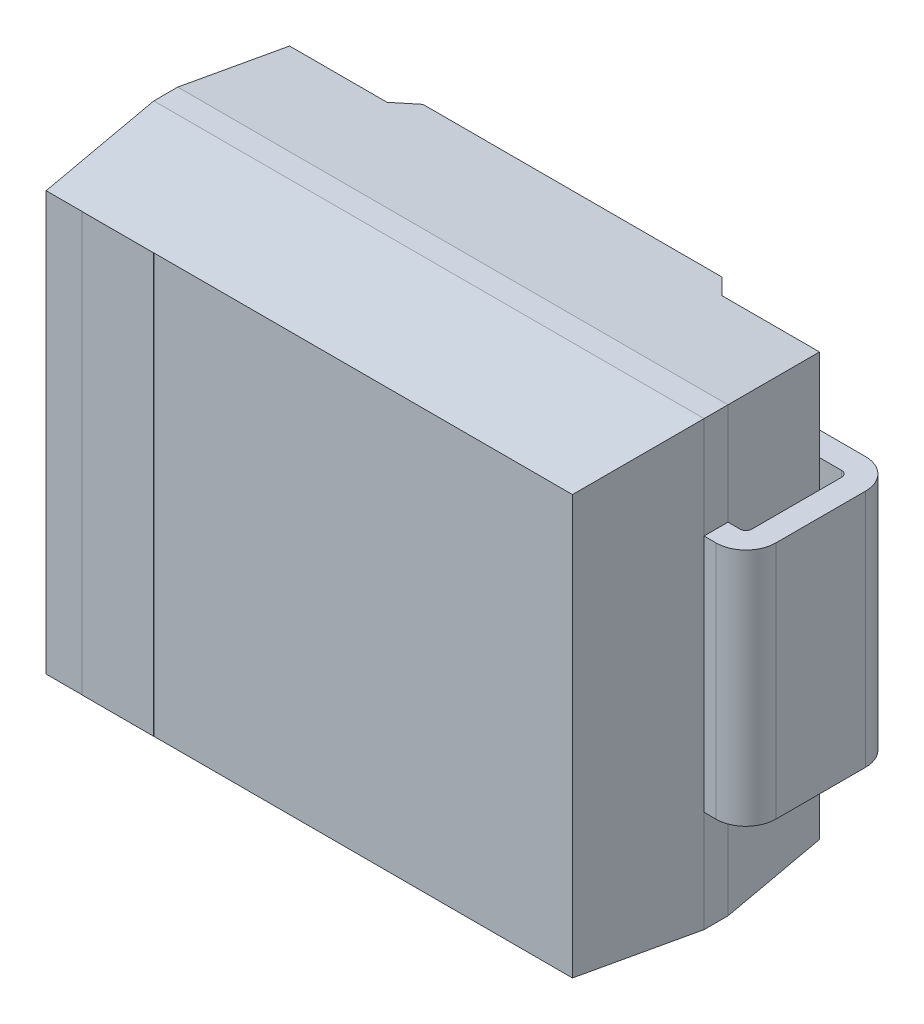
from build123d import *
from OCP.BRepFilletAPI import BRepFilletAPI_MakeChamfer

# Parameters (mm, degrees)
SZKIC1_W                    = 4.6
SZKIC1_H                    = 3.7
DODANIE_WYCI_GNI_CIE1_DEPTH = 2.2
SFAZOWANIE1_SIZE            = 1
SFAZOWANIE1_SIZE2           = 0.1
SFAZOWANIE2_SIZE            = 0.1
SFAZOWANIE2_SIZE2           = 1
SZKIC2_W                    = 0.6
SZKIC2_H                    = 3.5
DODANIE_WYCI_GNI_CIE2_DEPTH = 0.001
SZKIC5_W                    = 0.15
SZKIC5_H                    = 3.7
WYTNIJ_WYCI_GNI_CIE1_DEPTH  = 0.9
SFAZOWANIE3_SIZE            = 0.15
SZKIC3_W                    = 0.2
SZKIC3_H                    = 2
SFAZOWANIE3_OF_LUSTRO1_SIZE = 0.15


with BuildPart() as part:
    # Szkic1 → Dodanie-wyciągnięcie1 (new body)
    with BuildSketch(Plane.XY):
        Rectangle(SZKIC1_W, SZKIC1_H)
    extrude(amount=DODANIE_WYCI_GNI_CIE1_DEPTH)

    # Sfazowanie1: one chamfer whose edges measure the first distance from different faces: ONE call of the kernel's chamfer builder (chamfer() names one face for all edges)
    sfazowanie1_edges_1 = [part.edges().sort_by_distance(p)[0] for p in [
        (2.3, 0, 2.2),
    ]]
    sfazowanie1_side_1 = [part.faces().sort_by_distance(p)[0] for p in [
        (2.3, 0, 1.1),
    ]]
    sfazowanie1_edges_2 = [part.edges().sort_by_distance(p)[0] for p in [
        (0, 1.85, 2.2),
    ]]
    sfazowanie1_side_2 = [part.faces().sort_by_distance(p)[0] for p in [
        (0, 1.85, 1.1),
    ]]
    sfazowanie1_edges_3 = [part.edges().sort_by_distance(p)[0] for p in [
        (-2.3, 0, 2.2),
    ]]
    sfazowanie1_side_3 = [part.faces().sort_by_distance(p)[0] for p in [
        (-2.3, 0, 1.1),
    ]]
    sfazowanie1_edges_4 = [part.edges().sort_by_distance(p)[0] for p in [
        (0, -1.85, 2.2),
    ]]
    sfazowanie1_side_4 = [part.faces().sort_by_distance(p)[0] for p in [
        (0, -1.85, 1.1),
    ]]
    sfazowanie1 = BRepFilletAPI_MakeChamfer(part.part.solid().wrapped)
    for e in sfazowanie1_edges_1:
        sfazowanie1.Add(SFAZOWANIE1_SIZE, SFAZOWANIE1_SIZE2, e.wrapped, sfazowanie1_side_1[0].wrapped)  # the first distance lies on this face
    for e in sfazowanie1_edges_2:
        sfazowanie1.Add(SFAZOWANIE1_SIZE, SFAZOWANIE1_SIZE2, e.wrapped, sfazowanie1_side_2[0].wrapped)  # the first distance lies on this face
    for e in sfazowanie1_edges_3:
        sfazowanie1.Add(SFAZOWANIE1_SIZE, SFAZOWANIE1_SIZE2, e.wrapped, sfazowanie1_side_3[0].wrapped)  # the first distance lies on this face
    for e in sfazowanie1_edges_4:
        sfazowanie1.Add(SFAZOWANIE1_SIZE, SFAZOWANIE1_SIZE2, e.wrapped, sfazowanie1_side_4[0].wrapped)  # the first distance lies on this face
    add(Compound.cast(sfazowanie1.Shape()), mode=Mode.REPLACE)

    # Sfazowanie2
    sfazowanie2_edges = [part.edges().sort_by_distance(p)[0] for p in [
        (0, 1.85, 0),
        (2.3, 0, 0),
        (0, -1.85, 0),
        (-2.3, 0, 0),
    ]]
    sfazowanie2_side = [part.faces().sort_by_distance(p)[0] for p in [
        (0, 0, 0),
    ]]
    chamfer(sfazowanie2_edges, length=SFAZOWANIE2_SIZE, length2=SFAZOWANIE2_SIZE2, reference=sfazowanie2_side[0])

    # Szkic2 → Dodanie-wyciągnięcie2 (add)
    with BuildSketch(Plane.XY.offset(2.2)):
        with Locations((-1.6, 0)):
            Rectangle(SZKIC2_W, SZKIC2_H)
    extrude(amount=DODANIE_WYCI_GNI_CIE2_DEPTH)

    # Szkic5 → Wytnij-wyciągnięcie1 (cut)
    with BuildSketch(Plane.ZY.offset(2.3)):
        with Locations((0.075, 0)):
            Rectangle(SZKIC5_W, SZKIC5_H)
    wytnij_wyci_gni_cie1 = extrude(amount=-WYTNIJ_WYCI_GNI_CIE1_DEPTH, mode=Mode.SUBTRACT)

    # Sfazowanie3
    sfazowanie3_edges = [part.edges().sort_by_distance(p)[0] for p in [
        (-1.4, 0, 0),
    ]]
    chamfer(sfazowanie3_edges, length=SFAZOWANIE3_SIZE - 0.0001)  # a hair under: the kernel refuses the full size

    # Wyciągnięcie po ścieżce1: sweep along a path in Szkic4
    with BuildLine(Plane(origin=(0, 0, 0), x_dir=(1, 0, 0), z_dir=(0, 1, 0))) as wyci_gni_cie_po_cie_ce1_path:
        Line((-2.3, -1.2), (-2.4, -1.2))
        ThreePointArc((-2.4, -1.2), (-2.576776695, -1.126776695), (-2.65, -0.95))
        Line((-2.65, -0.95), (-2.65, -0.2))
        ThreePointArc((-2.65, -0.2), (-2.576776695, -0.023223305), (-2.4, 0.05))
        Line((-2.4, 0.05), (-1.55, 0.05))
    # Szkic3 → Wyciągnięcie po ścieżce1 (sweep)
    with BuildSketch(Plane.ZY.offset(2.3)):
        with Locations((1.1, 0)):
            Rectangle(SZKIC3_W, SZKIC3_H)
    wyci_gni_cie_po_cie_ce1 = sweep(path=wyci_gni_cie_po_cie_ce1_path.line)

    # Lustro1: Wytnij-wyciągnięcie1, Wyciągnięcie po ścieżce1 across plane
    add(wytnij_wyci_gni_cie1.mirror(Plane(origin=(0, 0, 0), x_dir=(0, 0, 1), z_dir=(1, 0, 0))), mode=Mode.SUBTRACT)
    add(wyci_gni_cie_po_cie_ce1.mirror(Plane(origin=(0, 0, 0), x_dir=(0, 0, 1), z_dir=(1, 0, 0))))

    # Sfazowanie3 of Lustro1
    sfazowanie3_of_lustro1_edges = [part.edges().sort_by_distance(p)[0] for p in [
        (1.4, 0, 0),
    ]]
    chamfer(sfazowanie3_of_lustro1_edges, length=SFAZOWANIE3_OF_LUSTRO1_SIZE - 0.0001)  # a hair under: the kernel refuses the full size


solid = part.part
